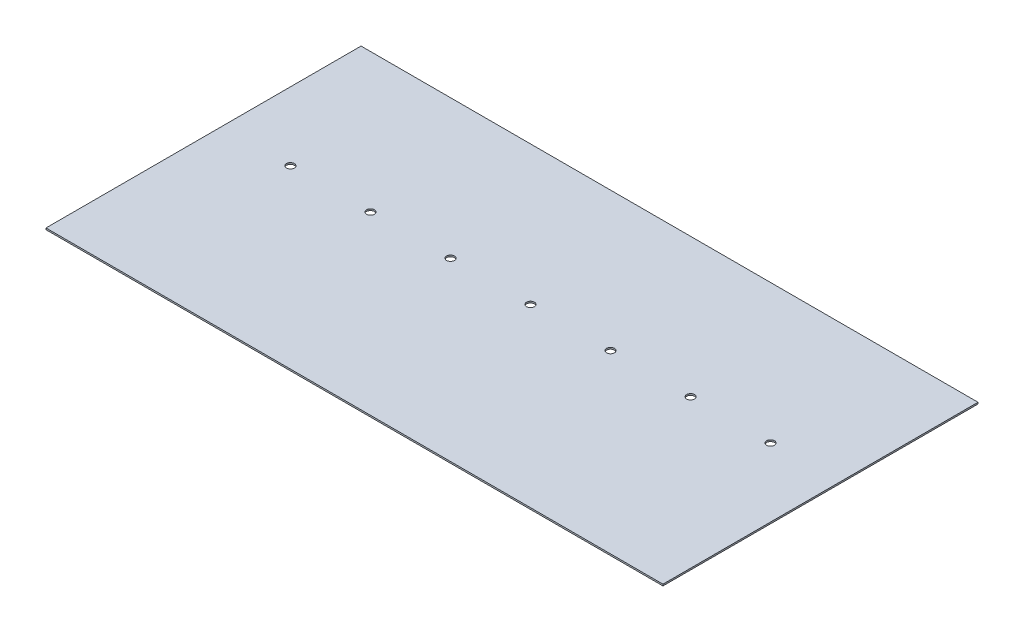
from build123d import *

# Parameters (mm, degrees)
SKETCH1_W           = 391.668
SKETCH1_H           = 199.9996
SKETCH1_R           = 2.5
BOSS_EXTRUDE1_DEPTH = 1


with BuildPart() as part:
    # Sketch1 → Boss-Extrude1 (new body)
    with BuildSketch(Plane(origin=(0, 0, 0), x_dir=(1, 0, 0), z_dir=(0, 1, 0))):
        with Locations((195.834, -99.9998)):
            Rectangle(SKETCH1_W, SKETCH1_H)
        with Locations((43.434, -88.2396)):
            Circle(SKETCH1_R, mode=Mode.SUBTRACT)
        with Locations((94.234, -88.2396)):
            Circle(SKETCH1_R, mode=Mode.SUBTRACT)
        with Locations((145.034, -88.2396)):
            Circle(SKETCH1_R, mode=Mode.SUBTRACT)
        with Locations((195.834, -88.2396)):
            Circle(SKETCH1_R, mode=Mode.SUBTRACT)
        with Locations((246.634, -88.2396)):
            Circle(SKETCH1_R, mode=Mode.SUBTRACT)
        with Locations((297.434, -88.2396)):
            Circle(SKETCH1_R, mode=Mode.SUBTRACT)
        with Locations((348.234, -88.2396)):
            Circle(SKETCH1_R, mode=Mode.SUBTRACT)
    extrude(amount=-BOSS_EXTRUDE1_DEPTH)


solid = part.part
